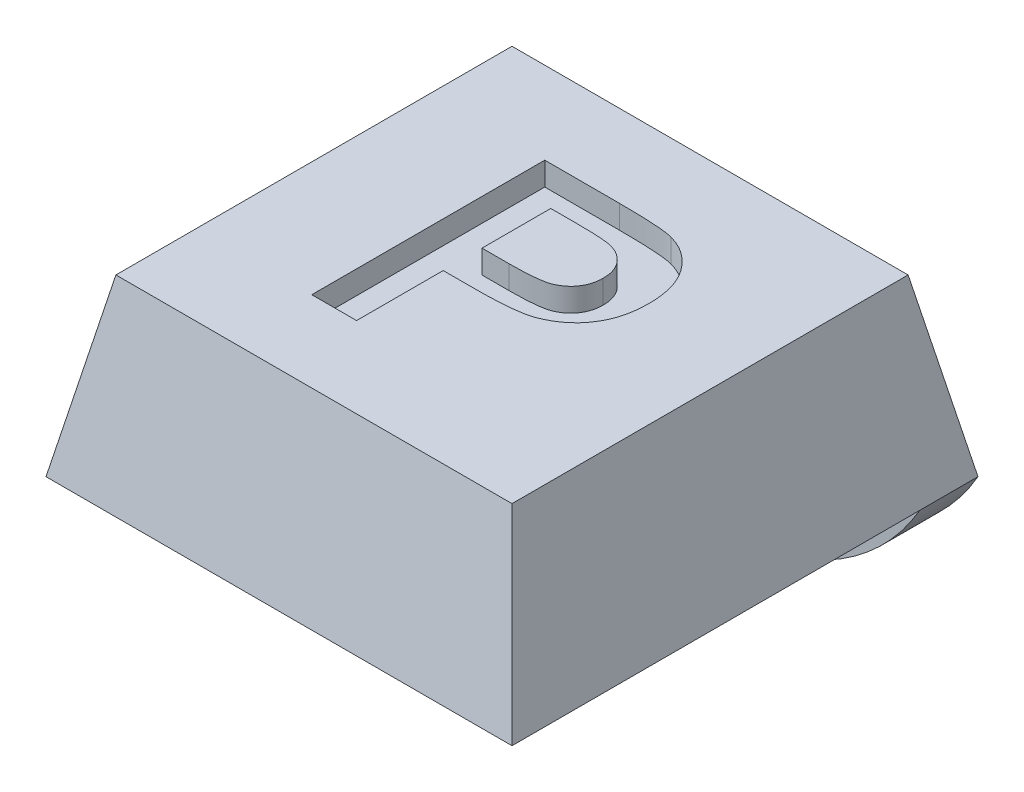
from build123d import *

# Parameters (mm, degrees)
SKETCH1_W               = 8
SKETCH1_H               = 8
BOSS_EXTRUDE1_DEPTH     = 3
CUT_EXTRUDE1_DEPTH      = 12.704699911
CUT_EXTRUDE1_DEPTH_BACK = 12.704699911
CUT_EXTRUDE2_DEPTH      = 11
SKETCH4_R               = 1.8
CUT_EXTRUDE3_DEPTH      = 0.8
SKETCH5_W               = 8
SKETCH5_H               = 1
BOSS_EXTRUDE2_DEPTH     = 2
FILLET1_R               = 4
CUT_EXTRUDE4_DEPTH      = 0.4


with BuildPart() as part:
    # Sketch1 → Boss-Extrude1 (new body)
    with BuildSketch(Plane(origin=(0, 0, 0), x_dir=(1, 0, 0), z_dir=(0, 1, 0))):
        with Locations((4, 4)):
            Rectangle(SKETCH1_W, SKETCH1_H)
    extrude(amount=BOSS_EXTRUDE1_DEPTH)

    # Sketch2 → Cut-Extrude1 (cut, two sides: drawn at the far end of the back side and taken through both)
    with BuildSketch(Plane.XY.offset(-CUT_EXTRUDE1_DEPTH_BACK)):
        Polygon((0, 0), (0.6, 3), (0, 3), align=None)
        Polygon((8, 0), (7.4, 3), (8, 3), align=None)
    extrude(amount=CUT_EXTRUDE1_DEPTH + CUT_EXTRUDE1_DEPTH_BACK, mode=Mode.SUBTRACT)

    # Sketch3 → Cut-Extrude2 (cut)
    with BuildSketch(Plane(origin=(0, 0, 0), x_dir=(0, 0, -1), z_dir=(1, 0, 0))):
        Polygon((0, 0), (0.6, 3), (0, 3), align=None)
        Polygon((8, 3), (7.4, 3), (8, 0), align=None)
    extrude(amount=CUT_EXTRUDE2_DEPTH, mode=Mode.SUBTRACT)

    # Sketch4 → Cut-Extrude3 (cut)
    with BuildSketch(Plane.XZ):
        with Locations(Location((4, -3.75, 0), (0, 0, 270))):
            Circle(SKETCH4_R)
    extrude(amount=-CUT_EXTRUDE3_DEPTH, mode=Mode.SUBTRACT)

    # Sketch5 → Boss-Extrude2 (add)
    with BuildSketch(Plane.XZ):
        with Locations((4, -7.5)):
            Rectangle(SKETCH5_W, SKETCH5_H)
    extrude(amount=BOSS_EXTRUDE2_DEPTH)

    # Fillet1
    # the kernel refuses this fillet: 4 mm, written as the material it takes off along each edge
    with BuildSketch(Plane(origin=(8, -2, -16.660254038), x_dir=(0, 1, 0), z_dir=(0, 0, 1)), Plane(origin=(0, -2, 1.660254038), x_dir=(0, 1, 0), z_dir=(0, 0, -1))) as fillet1_piece_1:
        with BuildLine():
            CenterArc((4, 3.464101615), FILLET1_R, 180, 60)
            Line((0, 3.464101615), (-0.08, 3.464101615))
            Line((-0.08, 3.464101615), (-0.08, 0))
            Line((-0.08, 0), (0, -0.08))
            ThreePointArc((0, -0.08), (1, -0.08), (1.96, -0.069282032))
            Line((1.96, -0.069282032), (2, 0))
        make_face()
    extrude(amount=18.320508076, mode=Mode.SUBTRACT)

    # Sketch6 → Cut-Extrude4 (cut)
    with BuildSketch(Plane(origin=(0, 3, 0), x_dir=(1, 0, 0), z_dir=(0, 1, 0))):
        with BuildLine():
            Line((2.575068598, 1.987434605), (2.575068598, 5.987434605))
            Line((2.575068598, 5.987434605), (3.854716034, 5.987434605))
            add(Edge.make_bspline(
                [(3.854716034, 5.987434605), (3.91267733, 5.987371309), (4.0235352, 5.987250247), (4.181667245, 5.983886636), (4.324041461, 5.979125075), (4.450446542, 5.973194752), (4.561327274, 5.964345571), (4.656186257, 5.954098352), (4.735620814, 5.943075064), (4.782397472, 5.931667436), (4.803433983, 5.926537169)],
                knots=[0, 0, 0, 0, 1.460485487, 2.793352117, 3.985295279, 5.050041172, 5.981765236, 6.787433016, 7.454681457, 8, 8, 8, 8], degree=3))
            add(Edge.make_bspline(
                [(4.803433983, 5.926537169), (4.831407427, 5.918560862), (4.886928159, 5.902729762), (4.966472056, 5.868980371), (5.043139776, 5.829866627), (5.115968073, 5.783250114), (5.185204512, 5.72995844), (5.251054895, 5.670426205), (5.313870394, 5.604384669), (5.372782037, 5.531964292), (5.426738172, 5.453530256), (5.473369829, 5.368966598), (5.512437408, 5.278640875), (5.545722335, 5.183231873), (5.570280113, 5.081716653), (5.587466094, 4.974800554), (5.59942968, 4.862436815), (5.600276739, 4.785544235), (5.600709624, 4.746248708)],
                knots=[0, 0, 0, 0, 0.907145743, 1.80047177, 2.69161667, 3.591261238, 4.495029544, 5.415863088, 6.359363025, 7.337192411, 8.326890979, 9.326929023, 10.346104993, 11.395420813, 12.477187422, 13.601053412, 14.774031606, 16, 16, 16, 16], degree=3))
            add(Edge.make_bspline(
                [(5.600709624, 4.746248708), (5.599475039, 4.686573982), (5.597098394, 4.571696857), (5.570507962, 4.407006575), (5.529951011, 4.256572619), (5.470674098, 4.121843981), (5.398403226, 4.002291963), (5.318795373, 3.894516382), (5.227894903, 3.801765706), (5.129684965, 3.722543108), (5.025895009, 3.65771062), (4.921917172, 3.602441845), (4.816348426, 3.559949444), (4.744371889, 3.541435164), (4.708882701, 3.5323064)],
                knots=[0, 0, 0, 0, 1.312386234, 2.526415563, 3.661883817, 4.733421185, 5.753802465, 6.732107337, 7.675884281, 8.604170108, 9.50284679, 10.365392406, 11.194030444, 12, 12, 12, 12], degree=3))
            add(Edge.make_bspline(
                [(4.708882701, 3.5323064), (4.683552258, 3.527487955), (4.630158709, 3.517331247), (4.545479732, 3.507206857), (4.452921022, 3.496000262), (4.352101878, 3.488690691), (4.243144264, 3.481845584), (4.126090489, 3.478613784), (4.001107836, 3.47472012), (3.91508314, 3.474650156), (3.870741675, 3.474614092)],
                knots=[0, 0, 0, 0, 0.735353946, 1.55003838, 2.431865514, 3.394945452, 4.432993119, 5.54609699, 6.735134699, 8, 8, 8, 8], degree=3))
            Line((3.870741675, 3.474614092), (3.344299367, 3.474614092))
            Line((3.344299367, 3.474614092), (3.344299367, 1.987434605))
            Line((3.344299367, 1.987434605), (2.575068598, 1.987434605))
        make_face()
        with BuildLine():
            Line((3.344299367, 5.320767939), (3.344299367, 4.141280759))
            Line((3.344299367, 4.141280759), (3.805837829, 4.141280759))
            add(Edge.make_bspline(
                [(3.805837829, 4.141280759), (3.845638333, 4.141332297), (3.921781705, 4.141430897), (4.031030553, 4.144970031), (4.129922714, 4.149290201), (4.218664819, 4.156440966), (4.296721198, 4.165865503), (4.364614575, 4.177138437), (4.422424078, 4.189235472), (4.484937186, 4.209282199), (4.551776196, 4.241715975), (4.623152404, 4.288331456), (4.685856319, 4.344065763), (4.738034287, 4.409523776), (4.779712931, 4.482251421), (4.809554871, 4.56150336), (4.828823783, 4.645966113), (4.830583823, 4.704475652), (4.831478855, 4.734229477)],
                knots=[0, 0, 0, 0, 1.411705958, 2.700771114, 3.876961699, 4.922619712, 5.858038221, 6.66485904, 7.363650596, 7.950905807, 8.989198271, 9.987739806, 10.967313358, 11.951275539, 12.944273208, 13.927870418, 14.946261014, 16, 16, 16, 16], degree=3))
            add(Edge.make_bspline(
                [(4.831478855, 4.734229477), (4.830219195, 4.770469172), (4.827776882, 4.840733161), (4.800844983, 4.940800809), (4.759292142, 5.031613413), (4.699883375, 5.110345382), (4.628118983, 5.176552494), (4.547458802, 5.231639165), (4.456180297, 5.270189236), (4.391579581, 5.285125966), (4.358722444, 5.292723067)],
                knots=[0, 0, 0, 0, 1.085904563, 2.105425768, 3.088705091, 4.068969419, 5.045188284, 6.010769642, 6.988240112, 8, 8, 8, 8], degree=3))
            add(Edge.make_bspline(
                [(4.358722444, 5.292723067), (4.344583268, 5.294984513), (4.31319868, 5.300004222), (4.261031108, 5.305242912), (4.199316862, 5.310007496), (4.127981551, 5.313919362), (4.047307931, 5.316977535), (3.957029905, 5.319657249), (3.857385235, 5.319872528), (3.787674783, 5.320461199), (3.751350649, 5.320767939)],
                knots=[0, 0, 0, 0, 0.564603001, 1.253243608, 2.066786758, 3.005752288, 4.070476343, 5.250658742, 6.567396469, 8, 8, 8, 8], degree=3))
            Line((3.751350649, 5.320767939), (3.344299367, 5.320767939))
        make_face(mode=Mode.SUBTRACT)
    extrude(amount=-CUT_EXTRUDE4_DEPTH, mode=Mode.SUBTRACT)


solid = part.part
